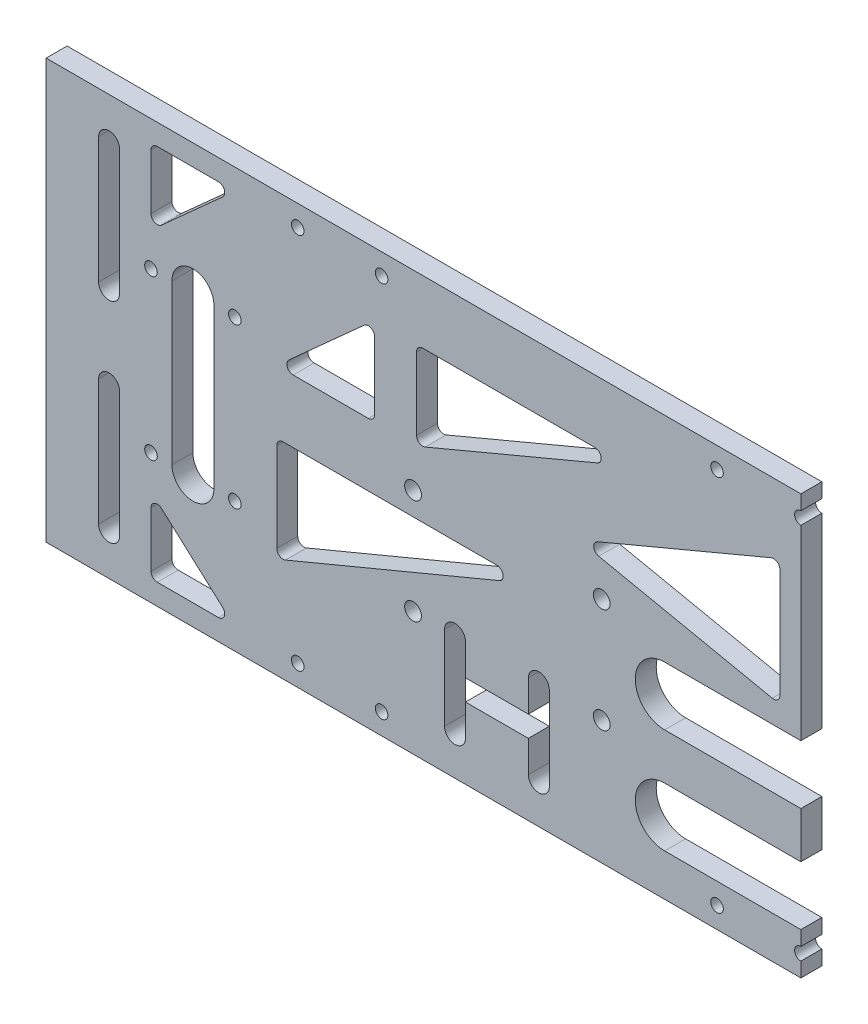
from build123d import *

# Parameters (mm, degrees)
SKETCH_1_W           = 320
SKETCH_1_H           = 121
EXTRUDE_1_DEPTH      = 5
SKETCH_2_W           = 5
SKETCH_2_H           = 30
CUT_EXTRUDE_1_DEPTH  = 343.14909031
SKETCH_3_R           = 1.5
CUT_EXTRUDE_2_DEPTH  = 343.14909031
SKETCH_4_R           = 1.5
CUT_EXTRUDE_3_DEPTH  = 343.14909031
SKETCH_6_R           = 2
CUT_EXTRUDE_5_DEPTH  = 343.14909031
SKETCH_5_W           = 250
SKETCH_5_H           = 30
CUT_EXTRUDE_4_DEPTH  = 343.14909031
SKETCH_7_W           = 260
SKETCH_7_H           = 30
EXTRUDE_2_DEPTH      = 5
SKETCH_8_W           = 320
SKETCH_8_H           = 21
CUT_EXTRUDE_6_DEPTH  = 5
SKETCH_9_W           = 15
SKETCH_9_H           = 100
EXTRUDE_3_DEPTH      = 5
CUT_EXTRUDE_7_DEPTH  = 5
CUT_EXTRUDE_8_DEPTH  = 5
SKETCH_15_R          = 1.5
CUT_EXTRUDE_9_DEPTH  = 357.217630108
CUT_EXTRUDE_10_DEPTH = 357.217630108
CUT_EXTRUDE_11_DEPTH = 357.217630108
SKETCH_18_W          = 5
SKETCH_18_H          = 100
EXTRUDE_4_DEPTH      = 5
SKETCH_19_W          = 180
SKETCH_19_H          = 100
CUT_EXTRUDE_13_DEPTH = 10
SKETCH_20_R          = 2
CUT_EXTRUDE_14_DEPTH = 10


with BuildPart() as part:
    # 草图1 → 凸台-拉伸1 (new body)
    with BuildSketch(Plane.XY):
        with Locations((160, 60.5)):
            Rectangle(SKETCH_1_W, SKETCH_1_H)
    extrude(amount=EXTRUDE_1_DEPTH)

    # 草图2 → 切除-拉伸1 (cut, through all)
    with BuildSketch(Plane.XY.offset(5)):
        with Locations((32.5, 15)):
            Rectangle(SKETCH_2_W, SKETCH_2_H)
        with Locations((287.5, 15)):
            Rectangle(SKETCH_2_W, SKETCH_2_H)
    extrude(amount=-CUT_EXTRUDE_1_DEPTH, mode=Mode.SUBTRACT)

    # 草图3 → 切除-拉伸2 (cut, through all)
    with BuildSketch(Plane.XY.offset(5)):
        with Locations((40, 116)):
            Circle(SKETCH_3_R)
        with Locations((60, 116)):
            Circle(SKETCH_3_R)
        with Locations((140, 116)):
            Circle(SKETCH_3_R)
        with Locations((160, 116)):
            Circle(SKETCH_3_R)
        with Locations((260, 116)):
            Circle(SKETCH_3_R)
        with Locations((280, 116)):
            Circle(SKETCH_3_R)
        with Locations((180, 116)):
            Circle(SKETCH_3_R)
    extrude(amount=-CUT_EXTRUDE_2_DEPTH, mode=Mode.SUBTRACT)

    # 草图4 → 切除-拉伸3 (cut, through all)
    with BuildSketch(Plane.XY.offset(5)):
        with Locations((5, 90)):
            Circle(SKETCH_4_R)
        with Locations((25, 90)):
            Circle(SKETCH_4_R)
        with Locations((5, 10)):
            Circle(SKETCH_4_R)
        with Locations((25, 10)):
            Circle(SKETCH_4_R)
        with Locations((295, 10)):
            Circle(SKETCH_4_R)
        with Locations((315, 10)):
            Circle(SKETCH_4_R)
        with Locations((295, 90)):
            Circle(SKETCH_4_R)
        with Locations((315, 90)):
            Circle(SKETCH_4_R)
    extrude(amount=-CUT_EXTRUDE_3_DEPTH, mode=Mode.SUBTRACT)

    # 草图6 → 切除-拉伸5 (cut, through all)
    with BuildSketch(Plane.XY.offset(5)):
        with Locations((112.5, 75.5)):
            Circle(SKETCH_6_R)
        with Locations((207.5, 75.5)):
            Circle(SKETCH_6_R)
        with Locations((207.5, 50.5)):
            Circle(SKETCH_6_R)
        with Locations((112.5, 50.5)):
            Circle(SKETCH_6_R)
        with BuildLine():
            Line((127.5, 70), (192.5, 70))
            ThreePointArc((192.5, 70), (199.5, 63), (192.5, 56))
            Line((192.5, 56), (127.5, 56))
            ThreePointArc((127.5, 56), (120.5, 63), (127.5, 70))
        make_face()
    extrude(amount=-CUT_EXTRUDE_5_DEPTH, mode=Mode.SUBTRACT)

    # 草图5 → 切除-拉伸4 (cut, through all)
    with BuildSketch(Plane.XY.offset(5)):
        with BuildLine():
            Line((5, 101.368043607), (5, 114.5))
            ThreePointArc((5, 114.5), (5.439339828, 115.560660172), (6.5, 116))
            Line((6.5, 116), (21.091062659, 116))
            ThreePointArc((21.091062659, 116), (22.491493276, 115.037395651), (22.094509756, 113.385058781))
            Line((22.094509756, 113.385058781), (7.503447097, 100.253102388))
            ThreePointArc((7.503447097, 100.253102388), (5.889742123, 99.997793512), (5, 101.368043607))
        make_face()
        with BuildLine():
            Line((38.908937341, 85), (56.833333333, 85))
            ThreePointArc((56.833333333, 85), (57.893993505, 85.439339828), (58.333333333, 86.5))
            Line((58.333333333, 86.5), (58.333333333, 102.631956393))
            ThreePointArc((58.333333333, 102.631956393), (57.443591211, 104.002206488), (55.829886236, 103.746897612))
            Line((55.829886236, 103.746897612), (37.905490244, 87.614941219))
            ThreePointArc((37.905490244, 87.614941219), (37.508506724, 85.962604349), (38.908937341, 85))
        make_face()
        with BuildLine():
            Line((35, 68.5), (35, 47.25))
            ThreePointArc((35, 47.25), (35.667949706, 46.001924558), (37.076923077, 45.865384615))
            Line((37.076923077, 45.865384615), (88.076923077, 67.115384615))
            ThreePointArc((88.076923077, 67.115384615), (88.970871014, 68.794174203), (87.5, 70))
            Line((87.5, 70), (36.5, 70))
            ThreePointArc((36.5, 70), (35.439339828, 69.560660172), (35, 68.5))
        make_face()
        with Locations((160, 15)):
            Rectangle(SKETCH_5_W, SKETCH_5_H)
        with BuildLine():
            Line((68.333333333, 87.256929624), (68.333333333, 104.5))
            ThreePointArc((68.333333333, 104.5), (68.772673162, 105.560660172), (69.833333333, 106))
            Line((69.833333333, 106), (110.888262801, 106))
            ThreePointArc((110.888262801, 106), (112.358715068, 104.796260242), (111.469111528, 103.117026842))
            Line((111.469111528, 103.117026842), (70.41418206, 85.873956465))
            ThreePointArc((70.41418206, 85.873956465), (69.00305419, 86.007675228), (68.333333333, 87.256929624))
        make_face()
        with BuildLine():
            Line((111.788920254, 84.01540935), (153.193641955, 75.376872258))
            ThreePointArc((153.193641955, 75.376872258), (154.446166722, 75.68130869), (155, 76.845253935))
            Line((155, 76.845253935), (155, 102.873774141))
            ThreePointArc((155, 102.873774141), (154.330279143, 104.123028536), (152.919151273, 104.256747299))
            Line((152.919151273, 104.256747299), (111.514429572, 86.866764185))
            ThreePointArc((111.514429572, 86.866764185), (110.602180826, 85.340055375), (111.788920254, 84.01540935))
        make_face()
        with BuildLine():
            Line((167.080848727, 104.256747299), (208.485570428, 86.866764185))
            ThreePointArc((208.485570428, 86.866764185), (209.397819174, 85.340055375), (208.211079746, 84.01540935))
            Line((208.211079746, 84.01540935), (166.806358045, 75.376872258))
            ThreePointArc((166.806358045, 75.376872258), (165.553833278, 75.68130869), (165, 76.845253935))
            Line((165, 76.845253935), (165, 102.873774141))
            ThreePointArc((165, 102.873774141), (165.669720857, 104.123028536), (167.080848727, 104.256747299))
        make_face()
        with BuildLine():
            Line((208.530888472, 103.117026842), (249.58581794, 85.873956465))
            ThreePointArc((249.58581794, 85.873956465), (250.99694581, 86.007675228), (251.666666667, 87.256929624))
            Line((251.666666667, 87.256929624), (251.666666667, 104.5))
            ThreePointArc((251.666666667, 104.5), (251.227326838, 105.560660172), (250.166666667, 106))
            Line((250.166666667, 106), (209.111737199, 106))
            ThreePointArc((209.111737199, 106), (207.641284932, 104.796260242), (208.530888472, 103.117026842))
        make_face()
        with BuildLine():
            Line((232.5, 70), (283.5, 70))
            ThreePointArc((283.5, 70), (284.560660172, 69.560660172), (285, 68.5))
            Line((285, 68.5), (285, 47.25))
            ThreePointArc((285, 47.25), (284.332050294, 46.001924558), (282.923076923, 45.865384615))
            Line((282.923076923, 45.865384615), (231.923076923, 67.115384615))
            ThreePointArc((231.923076923, 67.115384615), (231.029128986, 68.794174203), (232.5, 70))
        make_face()
        with BuildLine():
            Line((264.170113764, 103.746897612), (282.094509756, 87.614941219))
            ThreePointArc((282.094509756, 87.614941219), (282.491493276, 85.962604349), (281.091062659, 85))
            Line((281.091062659, 85), (263.166666667, 85))
            ThreePointArc((263.166666667, 85), (262.106006495, 85.439339828), (261.666666667, 86.5))
            Line((261.666666667, 86.5), (261.666666667, 102.631956393))
            ThreePointArc((261.666666667, 102.631956393), (262.556408789, 104.002206488), (264.170113764, 103.746897612))
        make_face()
        with BuildLine():
            Line((297.905490244, 113.385058781), (312.496552903, 100.253102388))
            ThreePointArc((312.496552903, 100.253102388), (314.110257877, 99.997793512), (315, 101.368043607))
            Line((315, 101.368043607), (315, 114.5))
            ThreePointArc((315, 114.5), (314.560660172, 115.560660172), (313.5, 116))
            Line((313.5, 116), (298.908937341, 116))
            ThreePointArc((298.908937341, 116), (297.508506724, 115.037395651), (297.905490244, 113.385058781))
        make_face()
    extrude(amount=-CUT_EXTRUDE_4_DEPTH, mode=Mode.SUBTRACT)

    # 草图7 → 凸台-拉伸2 (add)
    with BuildSketch(Plane(origin=(0, 0, 0), x_dir=(-1, 0, 0), z_dir=(0, 0, -1))):
        with Locations((-160, 15)):
            Rectangle(SKETCH_7_W, SKETCH_7_H)
    extrude(amount=-EXTRUDE_2_DEPTH)

    # 草图8 → 切除-拉伸6 (cut)
    with BuildSketch(Plane(origin=(0, 0, 0), x_dir=(-1, 0, 0), z_dir=(0, 0, -1))):
        with Locations((-160, 10.5)):
            Rectangle(SKETCH_8_W, SKETCH_8_H)
    extrude(amount=-CUT_EXTRUDE_6_DEPTH, mode=Mode.SUBTRACT)

    # 草图9 → 凸台-拉伸3 (add)
    with BuildSketch(Plane(origin=(0, 0, 0), x_dir=(-1, 0, 0), z_dir=(0, 0, -1))):
        with Locations((-327.5, 71)):
            Rectangle(SKETCH_9_W, SKETCH_9_H)
        with Locations((7.5, 71)):
            Rectangle(SKETCH_9_W, SKETCH_9_H)
    extrude(amount=-EXTRUDE_3_DEPTH)

    # 草图10 → 切除-拉伸7 (cut)
    with BuildSketch(Plane(origin=(0, 0, 0), x_dir=(-1, 0, 0), z_dir=(0, 0, -1))):
        with BuildLine():
            ThreePointArc((-327.5, 81), (-325, 78.5), (-322.5, 81))
            Line((-322.5, 81), (-322.5, 111))
            ThreePointArc((-322.5, 111), (-325, 113.5), (-327.5, 111))
            Line((-327.5, 111), (-327.5, 81))
        make_face()
        with BuildLine():
            ThreePointArc((-322.5, 61), (-325, 63.5), (-327.5, 61))
            Line((-327.5, 61), (-327.5, 31))
            ThreePointArc((-327.5, 31), (-325, 28.5), (-322.5, 31))
            Line((-322.5, 31), (-322.5, 61))
        make_face()
        with BuildLine():
            ThreePointArc((2.5, 81), (5, 78.5), (7.5, 81))
            Line((7.5, 81), (7.5, 111))
            ThreePointArc((7.5, 111), (5, 113.5), (2.5, 111))
            Line((2.5, 111), (2.5, 81))
        make_face()
        with BuildLine():
            ThreePointArc((7.5, 61), (5, 63.5), (2.5, 61))
            Line((2.5, 61), (2.5, 31))
            ThreePointArc((2.5, 31), (5, 28.5), (7.5, 31))
            Line((7.5, 31), (7.5, 61))
        make_face()
    extrude(amount=-CUT_EXTRUDE_7_DEPTH, mode=Mode.SUBTRACT)

    # 草图13 → 切除-拉伸8 (cut)
    with BuildSketch(Plane(origin=(0, 0, 0), x_dir=(-1, 0, 0), z_dir=(0, 0, -1))):
        with BuildLine():
            ThreePointArc((-192.5, 45), (-199.5, 38), (-192.5, 31))
            Line((-192.5, 31), (-127.5, 31))
            ThreePointArc((-127.5, 31), (-120.5, 38), (-127.5, 45))
            Line((-127.5, 45), (-192.5, 45))
        make_face()
    extrude(amount=-CUT_EXTRUDE_8_DEPTH, mode=Mode.SUBTRACT)

    # 草图15 → 切除-拉伸9 (cut, through all)
    with BuildSketch(Plane(origin=(0, 0, 0), x_dir=(-1, 0, 0), z_dir=(0, 0, -1))):
        with BuildLine():
            ThreePointArc((-22.094509756, 28.614941219), (-22.491493276, 26.962604349), (-21.091062659, 26))
            Line((-21.091062659, 26), (-6.5, 26))
            ThreePointArc((-6.5, 26), (-5.439339828, 26.439339828), (-5, 27.5))
            Line((-5, 27.5), (-5, 40.631956393))
            ThreePointArc((-5, 40.631956393), (-5.889742123, 42.002206488), (-7.503447097, 41.746897612))
            Line((-7.503447097, 41.746897612), (-22.094509756, 28.614941219))
        make_face()
        with BuildLine():
            Line((-315, 40.631956393), (-315, 27.5))
            ThreePointArc((-315, 27.5), (-314.560660172, 26.439339828), (-313.5, 26))
            Line((-313.5, 26), (-298.908937341, 26))
            ThreePointArc((-298.908937341, 26), (-297.508506724, 26.962604349), (-297.905490244, 28.614941219))
            Line((-297.905490244, 28.614941219), (-312.496552903, 41.746897612))
            ThreePointArc((-312.496552903, 41.746897612), (-314.110257877, 42.002206488), (-315, 40.631956393))
        make_face()
        with Locations((-25, 52)):
            Circle(SKETCH_15_R)
        with Locations((-5, 52)):
            Circle(SKETCH_15_R)
        with Locations((-40, 26)):
            Circle(SKETCH_15_R)
        with Locations((-60, 26)):
            Circle(SKETCH_15_R)
        with Locations((-140, 26)):
            Circle(SKETCH_15_R)
        with Locations((-160, 26)):
            Circle(SKETCH_15_R)
        with Locations((-180, 26)):
            Circle(SKETCH_15_R)
        with Locations((-260, 26)):
            Circle(SKETCH_15_R)
        with Locations((-280, 26)):
            Circle(SKETCH_15_R)
        with Locations((-295, 52)):
            Circle(SKETCH_15_R)
        with Locations((-315, 52)):
            Circle(SKETCH_15_R)
    extrude(amount=-CUT_EXTRUDE_9_DEPTH, mode=Mode.SUBTRACT)

    # 草图16 → 切除-拉伸10 (cut, through all)
    with BuildSketch(Plane(origin=(0, 0, 0), x_dir=(-1, 0, 0), z_dir=(0, 0, -1))):
        with BuildLine():
            Line((-310, 90), (-310, 52))
            ThreePointArc((-310, 52), (-305, 47), (-300, 52))
            Line((-300, 52), (-300, 90))
            ThreePointArc((-300, 90), (-305, 95), (-310, 90))
        make_face()
        with BuildLine():
            Line((-20, 90), (-20, 52))
            ThreePointArc((-20, 52), (-15, 47), (-10, 52))
            Line((-10, 52), (-10, 90))
            ThreePointArc((-10, 90), (-15, 95), (-20, 90))
        make_face()
    extrude(amount=-CUT_EXTRUDE_10_DEPTH, mode=Mode.SUBTRACT)

    # 草图17 → 切除-拉伸11 (cut, through all)
    with BuildSketch(Plane(origin=(0, 0, 0), x_dir=(-1, 0, 0), z_dir=(0, 0, -1))):
        with BuildLine():
            ThreePointArc((-220, 50.5), (-222.5, 53), (-225, 50.5))
            Line((-225, 50.5), (-225, 43))
            Line((-225, 43), (-240, 43))
            Line((-240, 43), (-240, 50.5))
            ThreePointArc((-240, 50.5), (-242.5, 53), (-245, 50.5))
            Line((-245, 50.5), (-245, 30.5))
            ThreePointArc((-245, 30.5), (-242.5, 28), (-240, 30.5))
            Line((-240, 30.5), (-240, 38))
            Line((-240, 38), (-225, 38))
            Line((-225, 38), (-225, 30.5))
            ThreePointArc((-225, 30.5), (-222.5, 28), (-220, 30.5))
            Line((-220, 30.5), (-220, 50.5))
        make_face()
        with BuildLine():
            ThreePointArc((-95, 50.5), (-97.5, 53), (-100, 50.5))
            Line((-100, 50.5), (-100, 30.5))
            ThreePointArc((-100, 30.5), (-97.5, 28), (-95, 30.5))
            Line((-95, 30.5), (-95, 38))
            Line((-95, 38), (-80, 38))
            Line((-80, 38), (-80, 30.5))
            ThreePointArc((-80, 30.5), (-77.5, 28), (-75, 30.5))
            Line((-75, 30.5), (-75, 50.5))
            ThreePointArc((-75, 50.5), (-77.5, 53), (-80, 50.5))
            Line((-80, 50.5), (-80, 43))
            Line((-80, 43), (-95, 43))
            Line((-95, 43), (-95, 50.5))
        make_face()
    extrude(amount=-CUT_EXTRUDE_11_DEPTH, mode=Mode.SUBTRACT)

    # 草图18 → 凸台-拉伸4 (add)
    with BuildSketch(Plane(origin=(0, 0, 0), x_dir=(-1, 0, 0), z_dir=(0, 0, -1))):
        with Locations((-337.5, 71)):
            Rectangle(SKETCH_18_W, SKETCH_18_H)
        with Locations((17.5, 71)):
            Rectangle(SKETCH_18_W, SKETCH_18_H)
    extrude(amount=-EXTRUDE_4_DEPTH)

    # 草图19 → 切除-拉伸13 (cut)
    with BuildSketch(Plane.XY.offset(5)):
        with Locations((250, 71)):
            Rectangle(SKETCH_19_W, SKETCH_19_H)
    extrude(amount=-CUT_EXTRUDE_13_DEPTH, mode=Mode.SUBTRACT)

    # 草图20 → 切除-拉伸14 (cut)
    with BuildSketch(Plane.XY.offset(5)):
        with Locations((67.5, 75.5)):
            Circle(SKETCH_20_R)
        with Locations((67.5, 50.5)):
            Circle(SKETCH_20_R)
    extrude(amount=-CUT_EXTRUDE_14_DEPTH, mode=Mode.SUBTRACT)


solid = part.part
